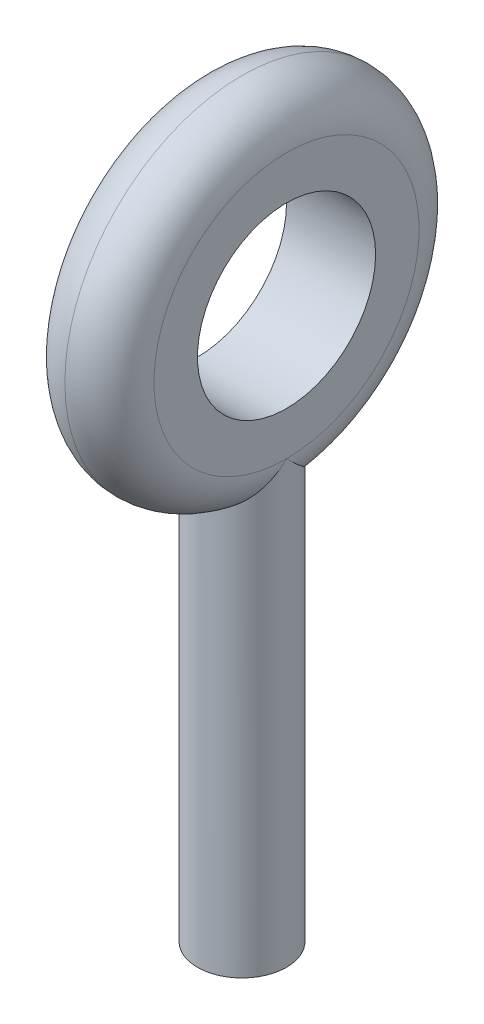
from build123d import *

# Parameters (mm, degrees)
SKETCH1_R           = 12.626048476
SKETCH1_R_2         = 6.35
BOSS_EXTRUDE1_DEPTH = 6.35
BOSS_EXTRUDE2_DEPTH = 6.35
SKETCH4_R           = 3.175
BOSS_EXTRUDE3_DEPTH = 50.8
CUT_EXTRUDE1_START  = -6.35
CUT_EXTRUDE1_DEPTH  = 6.35
SKETCH7_R           = 3.175
BOSS_EXTRUDE4_DEPTH = 57.15
SKETCH7_2_R         = 3.175
CUT_EXTRUDE2_DEPTH  = 25.4
FILLET1_R           = 3.175


with BuildPart() as part:
    # Sketch1 → Boss-Extrude1 (new body)
    with BuildSketch(Plane(origin=(0, 0, 0), x_dir=(0, 0, -1), z_dir=(1, 0, 0))):
        Circle(SKETCH1_R)
        Circle(SKETCH1_R_2, mode=Mode.SUBTRACT)
    extrude(amount=BOSS_EXTRUDE1_DEPTH)

    # Sketch3 → Boss-Extrude2 (add)
    with BuildSketch(Plane(origin=(6.35, 0, 0), x_dir=(0, 0, -1), z_dir=(1, 0, 0))):
        Polygon((-8.994798287, -8.860626609), (-8.994798287, -15.452306957), (10.798615768, -15.452306957), (10.798615768, -6.542705681), (-8.994798287, -6.542705681), align=None)
    extrude(amount=-BOSS_EXTRUDE2_DEPTH)

    # Sketch4 → Boss-Extrude3 (add)
    with BuildSketch(Plane.XZ.offset(15.452306957)):
        with Locations(Location((3.175, 0, 0), (0, 0, 180))):
            Circle(SKETCH4_R)
    extrude(amount=BOSS_EXTRUDE3_DEPTH)

    # Sketch5 → Cut-Extrude1 (cut)
    with BuildSketch(Plane(origin=(6.35, 0, 0), x_dir=(0, 0, -1), z_dir=(1, 0, 0)).offset(CUT_EXTRUDE1_START)):
        with BuildLine():
            Line((-8.994798287, -8.860626609), (-8.994798287, -15.452306957))
            Line((-8.994798287, -15.452306957), (10.798615768, -15.452306957))
            Line((10.798615768, -15.452306957), (10.798615768, -6.542705681))
            ThreePointArc((10.798615768, -6.542705681), (1.46854647, -12.540353719), (-8.994798287, -8.860626609))
        make_face()
    extrude(amount=CUT_EXTRUDE1_DEPTH, mode=Mode.SUBTRACT)


with BuildPart() as cut_extrude1_piece_1:
    # of the separate pieces the step leaves, piece 1, a body of its own (cut_extrude1_pieces)
    add(part.part.solids().sort_by_distance((0, -6.542705681, -10.798615768))[0])



with BuildPart() as cut_extrude1_piece_2:
    # of the separate pieces the step leaves, piece 2, a body of its own (cut_extrude1_pieces)
    add(part.part.solids().sort_by_distance((0, -15.452306957, 0))[0])


with BuildPart() as cut_extrude1_piece_1_1:
    add(cut_extrude1_piece_1.part)

    add(cut_extrude1_piece_2.part)  # Boss-Extrude4 merges Cut-Extrude1 piece 2
    # Sketch7 → Boss-Extrude4 (add)
    with BuildSketch(Plane.XZ.offset(66.252306957)):
        with Locations((3.175, 0)):
            Circle(SKETCH7_R)
    extrude(amount=-BOSS_EXTRUDE4_DEPTH)

    # Sketch7<2> → Cut-Extrude2 (cut)
    with BuildSketch(Plane.XZ.offset(66.252306957)):
        with Locations((3.175, 0)):
            Circle(SKETCH7_2_R)
    extrude(amount=-CUT_EXTRUDE2_DEPTH, mode=Mode.SUBTRACT)

    # Fillet1
    # the kernel refuses this fillet: 3.175 mm, written as the material it takes off along each edge
    with BuildSketch(Plane(origin=(6.35, 0, 0), x_dir=(0, -0.7017735299957855, 0.7124001071008161), z_dir=(0, -0.7124001071008161, -0.7017735299957855))) as fillet1_piece_1:
        with BuildLine():
            CenterArc((12.626048476 - FILLET1_R, FILLET1_R), FILLET1_R, 270, 90)
            Line((12.626048476 - FILLET1_R, 0), (12.626048476, 0))
            Line((12.626048476, 0), (12.626048476, FILLET1_R))
        make_face()
    revolve(axis=Axis((6.35, 0, 0), (-1, 0, 0)), revolution_arc=255.78045899, mode=Mode.SUBTRACT)
    with BuildSketch(Plane(origin=(0, 0, 0), x_dir=(0, -0.5181910787843432, -0.855264874684047), z_dir=(0, -0.855264874684047, 0.5181910787843432))) as fillet1_piece_2:
        with BuildLine():
            CenterArc((12.626048476 - FILLET1_R, FILLET1_R), FILLET1_R, 270, 90)
            Line((12.626048476 - FILLET1_R, 0), (12.626048476, 0))
            Line((12.626048476, 0), (12.626048476, FILLET1_R))
        make_face()
    revolve(axis=Axis((0, 0, 0), (1, 0, 0)), revolution_arc=255.78045899, mode=Mode.SUBTRACT)
    with BuildSketch(Plane(origin=(0, 0, 0), x_dir=(0, -0.5181910787843435, -0.8552648746840469), z_dir=(0, 0.8552648746840469, -0.5181910787843435))) as fillet1_piece_3_section:
        with BuildLine():
            CenterArc((12.626048476 - FILLET1_R, -FILLET1_R), FILLET1_R, 0, 90)
            Line((12.626048476 - FILLET1_R, 0), (12.626048476, 0))
            Line((12.626048476, 0), (12.626048476, -FILLET1_R))
        make_face()
    fillet1_piece_3 = revolve(axis=Axis((0, 0, 0), (-1, 0, 0)), revolution_arc=58.789009325, mode=Mode.PRIVATE)
    fillet1_piece_3 = fillet1_piece_3 - Plane(origin=(3.175, -9.611252213, 0), x_dir=(1, 0, 0), z_dir=(0, -1, 0)) * Cylinder(3.175, 51, mode=Mode.PRIVATE)
    add(fillet1_piece_3, mode=Mode.SUBTRACT)
    with BuildSketch(Plane(origin=(0, 0, 0), x_dir=(0, -1, 0), z_dir=(0, 0, -1))) as fillet1_piece_4_section:
        with BuildLine():
            CenterArc((12.626048476 - FILLET1_R, -FILLET1_R), FILLET1_R, 0, 90)
            Line((12.626048476 - FILLET1_R, 0), (12.626048476, 0))
            Line((12.626048476, 0), (12.626048476, -FILLET1_R))
        make_face()
    fillet1_piece_4 = revolve(axis=Axis((0, 0, 0), (-1, 0, 0)), revolution_arc=45.430531685, mode=Mode.PRIVATE)
    fillet1_piece_4 = fillet1_piece_4 - Plane(origin=(3.175, -10.439695548, 0), x_dir=(1, 0, 0), z_dir=(0, -1, 0)) * Cylinder(3.175, 51, mode=Mode.PRIVATE)
    add(fillet1_piece_4, mode=Mode.SUBTRACT)
    with BuildSketch(Plane(origin=(6.35, 0, 0), x_dir=(0, -1, 0), z_dir=(0, 0, -1))) as fillet1_piece_5_section:
        with BuildLine():
            CenterArc((12.626048476 - FILLET1_R, FILLET1_R), FILLET1_R, 270, 90)
            Line((12.626048476 - FILLET1_R, 0), (12.626048476, 0))
            Line((12.626048476, 0), (12.626048476, FILLET1_R))
        make_face()
    fillet1_piece_5 = revolve(axis=Axis((6.35, 0, 0), (-1, 0, 0)), revolution_arc=45.430531685, mode=Mode.PRIVATE)
    fillet1_piece_5 = fillet1_piece_5 - Plane(origin=(3.175, -10.439696502, 0), x_dir=(1, 0, 0), z_dir=(0, -1, 0)) * Cylinder(3.175, 51, mode=Mode.PRIVATE)
    add(fillet1_piece_5, mode=Mode.SUBTRACT)
    with BuildSketch(Plane(origin=(6.35, 0, 0), x_dir=(0, -0.5181910787843435, -0.8552648746840469), z_dir=(0, 0.8552648746840469, -0.5181910787843435))) as fillet1_piece_6_section:
        with BuildLine():
            CenterArc((12.626048476 - FILLET1_R, FILLET1_R), FILLET1_R, 270, 90)
            Line((12.626048476 - FILLET1_R, 0), (12.626048476, 0))
            Line((12.626048476, 0), (12.626048476, FILLET1_R))
        make_face()
    fillet1_piece_6 = revolve(axis=Axis((6.35, 0, 0), (-1, 0, 0)), revolution_arc=58.789009325, mode=Mode.PRIVATE)
    fillet1_piece_6 = fillet1_piece_6 - Plane(origin=(3.175, -9.611252422, 0), x_dir=(1, 0, 0), z_dir=(0, -1, 0)) * Cylinder(3.175, 51, mode=Mode.PRIVATE)
    add(fillet1_piece_6, mode=Mode.SUBTRACT)


solid = cut_extrude1_piece_1_1.part
